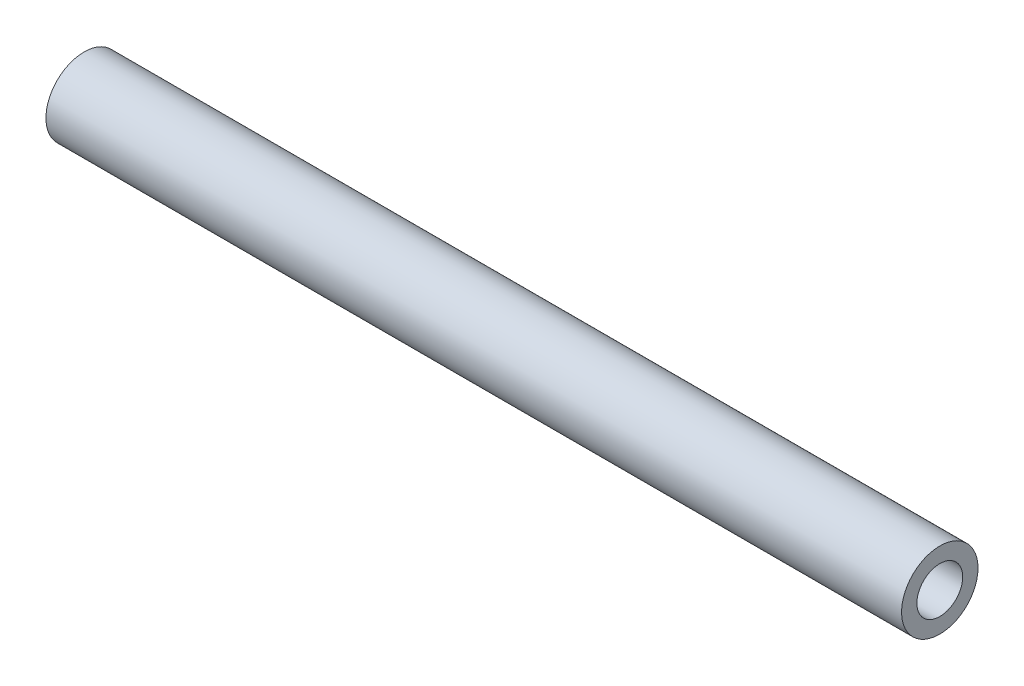
from build123d import *

# Parameters (mm, degrees)
SKETCH1_R           = 7.9375
SKETCH1_R_2         = 4.7625
BOSS_EXTRUDE1_DEPTH = 88.9


with BuildPart() as part:
    # Sketch1 → Boss-Extrude1 (new, symmetric)
    with BuildSketch(Plane(origin=(0, 0, 0), x_dir=(0, 0, -1), z_dir=(1, 0, 0))):
        Circle(SKETCH1_R)
        Circle(SKETCH1_R_2, mode=Mode.SUBTRACT)
    extrude(amount=BOSS_EXTRUDE1_DEPTH, both=True)


solid = part.part
